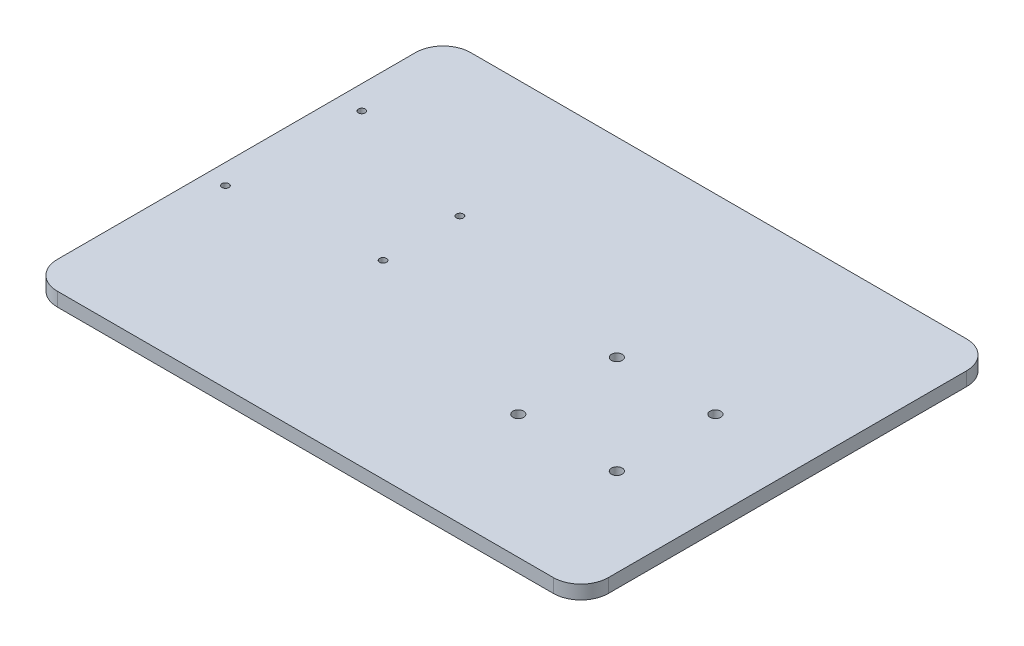
from build123d import *

# Parameters (mm, degrees)
BOSS_EXTRUDE1_DEPTH = 5
ARDUINO_UNO_HOLES_D = 2.5
L298N_HOLES_D       = 3.9116
L298N_HOLES_DEPTH   = 5
L298N_HOLES_TIP     = 1.175163199


with BuildPart() as part:
    # Sketch1 → Boss-Extrude1 (new body)
    with BuildSketch(Plane(origin=(0, 0, 0), x_dir=(1, 0, 0), z_dir=(0, 1, 0))):
        with BuildLine():
            Line((-90, -75), (90, -75))
            ThreePointArc((90, -75), (97.071067812, -72.071067812), (100, -65))
            Line((100, -65), (100, 65))
            ThreePointArc((100, 65), (97.071067812, 72.071067812), (90, 75))
            Line((90, 75), (-90, 75))
            ThreePointArc((-90, 75), (-97.071067812, 72.071067812), (-100, 65))
            Line((-100, 65), (-100, -65))
            ThreePointArc((-100, -65), (-97.071067812, -72.071067812), (-90, -75))
        make_face()
    extrude(amount=BOSS_EXTRUDE1_DEPTH)

    # arduino uno holes (through all)
    with Locations(Plane(origin=(0, 5, 0), x_dir=(1, 0, 0), z_dir=(0, 1, 0))):
        with Locations((-40.586984591, 21.684273772), (-40.586984591, -6.215726228), (-91.386984591, 36.884273772), (-92.686984591, -11.315726228)):
            Hole(ARDUINO_UNO_HOLES_D / 2)

    # l298n holes
    with Locations(Plane(origin=(0, 5, 0), x_dir=(1, 0, 0), z_dir=(0, 1, 0))):
        with Locations((32.322948554, 5.731881548), (68.082948554, 5.731881548), (32.322948554, -30.028118452), (68.082948554, -30.028118452)):
            Hole(L298N_HOLES_D / 2, depth=L298N_HOLES_DEPTH)
            with Locations((0, 0, -(L298N_HOLES_DEPTH + L298N_HOLES_TIP / 2))):  # 118° drill point
                Cone(0, L298N_HOLES_D / 2, L298N_HOLES_TIP, mode=Mode.SUBTRACT)


solid = part.part
